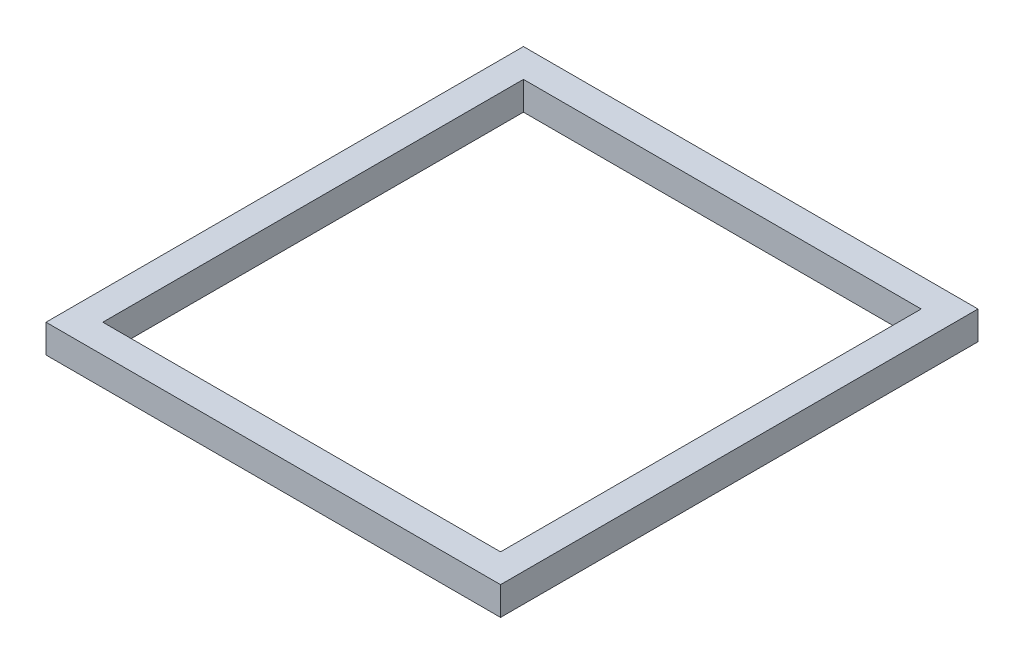
from build123d import *

# Parameters (mm, degrees)
SKETCH1_W           = 25.4
SKETCH1_H           = 26.68
SKETCH1_W_2         = 22.225
SKETCH1_H_2         = 23.505
BOSS_EXTRUDE1_DEPTH = 1.5875


with BuildPart() as part:
    # Sketch1 → Boss-Extrude1 (new body)
    with BuildSketch(Plane(origin=(0, 0, 0), x_dir=(1, 0, 0), z_dir=(0, 1, 0))):
        with Locations((12.7, 13.34)):
            Rectangle(SKETCH1_W, SKETCH1_H)
        with Locations((12.7, 13.34)):
            Rectangle(SKETCH1_W_2, SKETCH1_H_2, mode=Mode.SUBTRACT)
    extrude(amount=BOSS_EXTRUDE1_DEPTH)


solid = part.part
